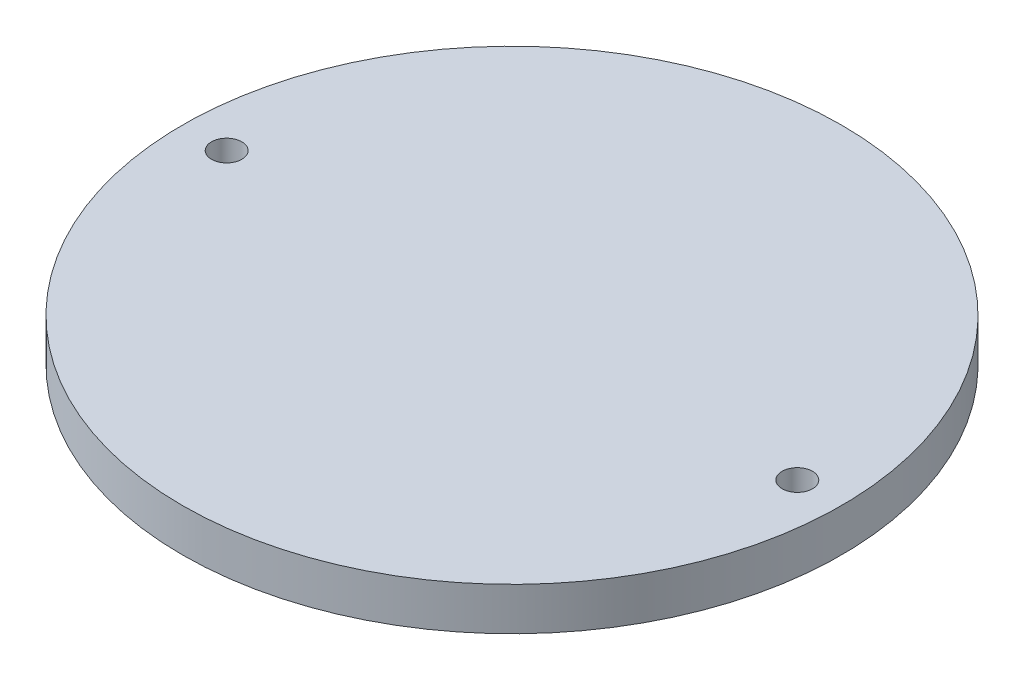
from build123d import *

# Parameters (mm, degrees)
SKETCH2_R               = 73.3425
BOSS_EXTRUDE1_DEPTH     = 9.525
F_1_4_CLEARANCE_HOLE1_D = 6.7564


with BuildPart() as part:
    # Sketch2 → Boss-Extrude1 (new body)
    with BuildSketch(Plane(origin=(0, 0, 0), x_dir=(1, 0, 0), z_dir=(0, 1, 0))):
        Circle(SKETCH2_R)
    extrude(amount=BOSS_EXTRUDE1_DEPTH)

    # 1/4 Clearance Hole1 (through all)
    with Locations(Plane(origin=(0, 9.525, 0), x_dir=(1, 0, 0), z_dir=(0, 1, 0))):
        with Locations((-63.5, 0), (63.5, 0)):
            Hole(F_1_4_CLEARANCE_HOLE1_D / 2)


solid = part.part
